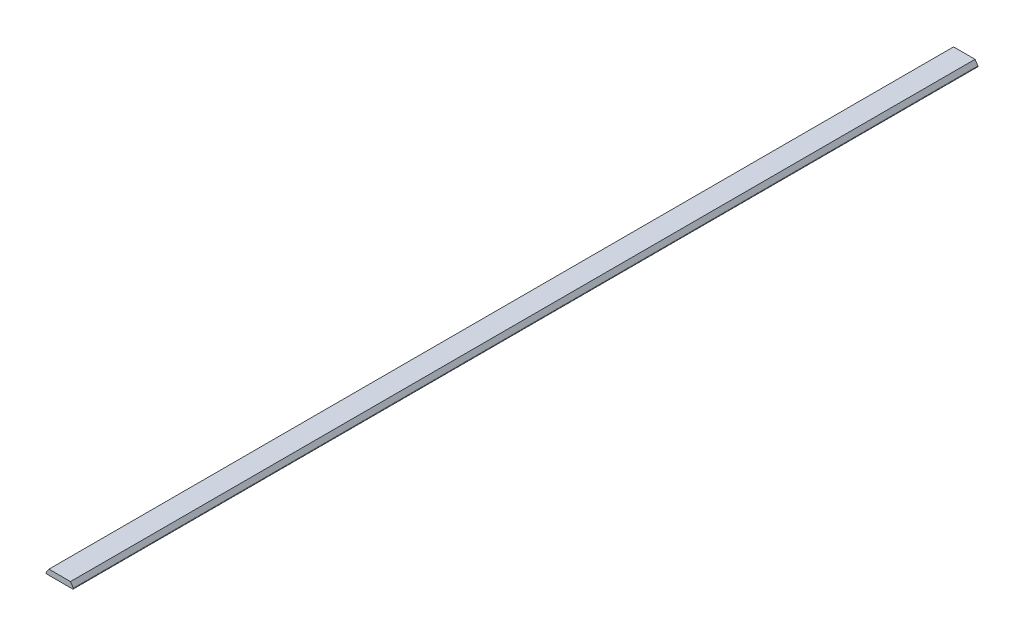
from build123d import *

# Parameters (mm, degrees)
BOSS_EXTRUDE1_DEPTH = 925


with BuildPart() as part:
    # Sketch1 → Boss-Extrude1 (new body)
    with BuildSketch(Plane.XY):
        with BuildLine():
            Line((0, 5.5), (-2.875052696, 1.164498646))
            ThreePointArc((-2.875052696, 1.164498646), (-2.910822966, 0.395298706), (-2.25, 0))
            Line((-2.25, 0), (0, 0))
            Line((0, 0), (22, 0))
            Line((22, 0), (24.25, 0))
            ThreePointArc((24.25, 0), (24.910822966, 0.395298706), (24.875052696, 1.164498646))
            Line((24.875052696, 1.164498646), (22, 5.5))
            Line((22, 5.5), (0, 5.5))
        make_face()
    extrude(amount=BOSS_EXTRUDE1_DEPTH)


solid = part.part
